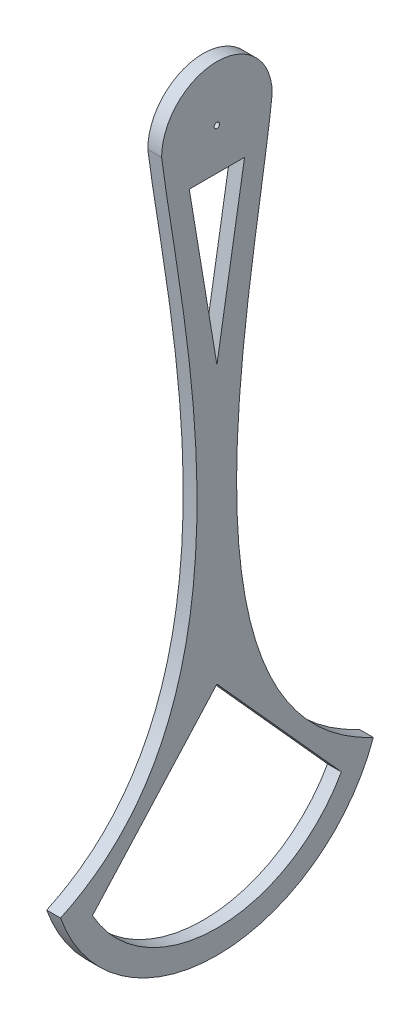
from build123d import *

# Parameters (mm, degrees)
ESQUISSE1_R             = 1
BOSS_EXTRU_1_DEPTH      = 5
ESQUISSE2_R             = 3
ENL_V_MAT_EXTRU_1_DEPTH = 2
BOSS_EXTRU_2_START      = 3
ESQUISSE3_R             = 10
ESQUISSE3_R_2           = 3
BOSS_EXTRU_2_DEPTH      = 3
CHANFREIN1_SIZE         = 3


with BuildPart() as part:
    # Esquisse1 → Boss.-Extru.1 (new body)
    with BuildSketch(Plane(origin=(0, 0, 0), x_dir=(0, 0, -1), z_dir=(1, 0, 0))):
        with BuildLine():
            ThreePointArc((20, 0), (0, 20), (-20, 0))
            add(Edge.make_bspline(
                [(-56.568542495, -220), (19.779297851, -184.881212826), (-13.461804543, -52.728965786), (-20, 0)],
                knots=[0, 0, 0, 0, 1, 1, 1, 1], degree=3))
            ThreePointArc((-56.568542495, -220), (0, -260), (56.568542495, -220))
            add(Edge.make_bspline(
                [(56.568542495, -220), (-20.766043456, -183.938290331), (14.228843578, -53.461939266), (20, 0)],
                knots=[0, 0, 0, 0, 1, 1, 1, 1], degree=3))
        make_face()
        Circle(ESQUISSE1_R, mode=Mode.SUBTRACT)
        with BuildLine():
            Line((45, -225), (0, -175))
            Line((0, -175), (-45, -225))
            ThreePointArc((-45, -225), (0, -251.478150705), (45, -225))
        make_face(mode=Mode.SUBTRACT)
        Polygon((-10, -15), (10, -15), (0, -75), align=None, mode=Mode.SUBTRACT)
    extrude(amount=BOSS_EXTRU_1_DEPTH)

    # Esquisse2 → Enlèv. mat.-Extru.1 (cut)
    with BuildSketch(Plane.ZY):
        Circle(ESQUISSE2_R)
    extrude(amount=-ENL_V_MAT_EXTRU_1_DEPTH, mode=Mode.SUBTRACT)

    # Esquisse3 → Boss.-Extru.2 (add)
    with BuildSketch(Plane.ZY.offset(BOSS_EXTRU_2_START)):
        Circle(ESQUISSE3_R)
        Circle(ESQUISSE3_R_2, mode=Mode.SUBTRACT)
    extrude(amount=-BOSS_EXTRU_2_DEPTH)

    # Chanfrein1
    chanfrein1_edges = [part.edges().sort_by_distance(p)[0] for p in [
        (-3, 0, -10),
    ]]
    chamfer(chanfrein1_edges, length=CHANFREIN1_SIZE - 0.0001)  # a hair under: the kernel refuses the full size


solid = part.part
